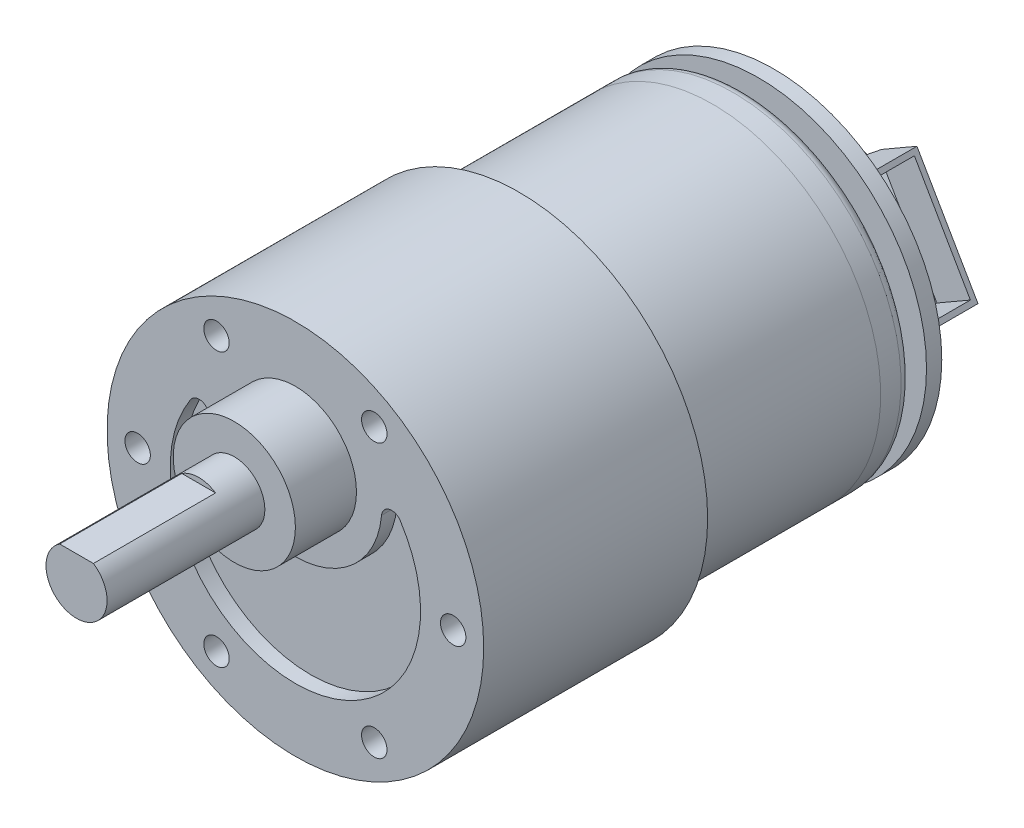
from build123d import *

# Parameters (mm, degrees)
SKETCH1_R            = 18.5
BOSS_EXTRUDE1_DEPTH  = 22
SKETCH2_R            = 1.25
CUT_EXTRUDE1_DEPTH   = 5
SKETCH3_R            = 6
BOSS_EXTRUDE2_DEPTH  = 6
SKETCH4_R            = 3
BOSS_EXTRUDE3_DEPTH  = 15.5
SKETCH5_OUTSIDE_W    = 52.61
SKETCH5_OUTSIDE_H    = 52.61
CUT_EXTRUDE2_DEPTH   = 12
CUT_EXTRUDE3_DEPTH   = 1.5
FILLET1_R            = 1
SKETCH7_R            = 16.5
BOSS_EXTRUDE4_DEPTH  = 19
SKETCH8_R            = 16.5
BOSS_EXTRUDE5_DEPTH  = 3
FILLET2_R            = 1
BOSS_EXTRUDE6_START  = 10
SKETCH9_R            = 7.5
BOSS_EXTRUDE6_DEPTH  = 3.5
BOSS_EXTRUDE7_START  = -4
SKETCH10_R           = 1.5
BOSS_EXTRUDE7_DEPTH  = 10.5
BOSS_EXTRUDE8_START  = 5
SKETCH11_R           = 16.5
SKETCH11_R_2         = 2.25
BOSS_EXTRUDE8_DEPTH  = 1.5
SKETCH12_W           = 1
SKETCH12_H           = 3
BOSS_EXTRUDE9_DEPTH  = 1.5
BOSS_EXTRUDE10_DEPTH = 4.5
CHAMFER1_SIZE        = 2
CUT_EXTRUDE4_START   = -0.5
CUT_EXTRUDE4_DEPTH   = 11
FILLET3_R            = 1
FILLET4_R            = 0.5


with BuildPart() as part:
    # Sketch1 → Boss-Extrude1 (new body)
    with BuildSketch(Plane.XY):
        Circle(SKETCH1_R)
    extrude(amount=-BOSS_EXTRUDE1_DEPTH)

    # Sketch2 → Cut-Extrude1 (cut)
    with BuildSketch(Plane.XY):
        with Locations((-15.5, 0)):
            Circle(SKETCH2_R)
        with Locations((-7.75, 13.423393759)):
            Circle(SKETCH2_R)
        with Locations((7.75, 13.423393759)):
            Circle(SKETCH2_R)
        with Locations((15.5, 0)):
            Circle(SKETCH2_R)
        with Locations((7.75, -13.423393759)):
            Circle(SKETCH2_R)
        with Locations((-7.75, -13.423393759)):
            Circle(SKETCH2_R)
    extrude(amount=-CUT_EXTRUDE1_DEPTH, mode=Mode.SUBTRACT)

    # Sketch3 → Boss-Extrude2 (add)
    with BuildSketch(Plane.XY):
        with Locations((0, 7)):
            Circle(SKETCH3_R)
    extrude(amount=BOSS_EXTRUDE2_DEPTH)

    # Sketch4 → Boss-Extrude3 (add)
    with BuildSketch(Plane.XY.offset(6)):
        with Locations((0, 7)):
            Circle(SKETCH4_R)
    extrude(amount=BOSS_EXTRUDE3_DEPTH)

    # Sketch5 outside → Cut-Extrude2 (cut)
    with BuildSketch(Plane.XY.offset(21.5)):
        Rectangle(SKETCH5_OUTSIDE_W, SKETCH5_OUTSIDE_H)
        with BuildLine():
            Line((-1.658312395, 9.5), (1.658312395, 9.5))
            ThreePointArc((1.658312395, 9.5), (0, 4), (-1.658312395, 9.5))
        make_face(mode=Mode.SUBTRACT)
    extrude(amount=-CUT_EXTRUDE2_DEPTH, mode=Mode.SUBTRACT)

    # Sketch6 → Cut-Extrude3 (cut)
    with BuildSketch(Plane.XY):
        with BuildLine():
            ThreePointArc((-8.226916879, 9.137250258), (0, -12.29518213), (8.226916879, 9.137250258))
            ThreePointArc((8.226916879, 9.137250258), (0, -1.5), (-8.226916879, 9.137250258))
        make_face()
    extrude(amount=-CUT_EXTRUDE3_DEPTH, mode=Mode.SUBTRACT)

    # Fillet1
    fillet1_edges = [part.edges().sort_by_distance(p)[0] for p in [
        (-8.226916879, 9.137250258, -0.75),
        (8.226916879, 9.137250258, -0.75),
    ]]
    fillet(fillet1_edges, radius=FILLET1_R)

    # Sketch7 → Boss-Extrude4 (add)
    with BuildSketch(Plane(origin=(0, 0, -22), x_dir=(-1, 0, 0), z_dir=(0, 0, -1))):
        Circle(SKETCH7_R)
    extrude(amount=BOSS_EXTRUDE4_DEPTH)


with BuildPart() as body_2:
    # Sketch8 → Boss-Extrude5 (new body)
    with BuildSketch(Plane(origin=(0, 0, -41), x_dir=(-1, 0, 0), z_dir=(0, 0, -1))):
        Circle(SKETCH8_R)
    extrude(amount=BOSS_EXTRUDE5_DEPTH)

    # Fillet2
    fillet2_edges = [body_2.edges().sort_by_distance(p)[0] for p in [
        (16.5, 0, -44),
    ]]
    fillet(fillet2_edges, radius=FILLET2_R)



with BuildPart() as body_3:
    # Sketch9 → Boss-Extrude6 (new body)
    with BuildSketch(Plane(origin=(0, 0, -44), x_dir=(-1, 0, 0), z_dir=(0, 0, -1)).offset(BOSS_EXTRUDE6_START)):
        Circle(SKETCH9_R)
    extrude(amount=-BOSS_EXTRUDE6_DEPTH)


with BuildPart() as body_2_1:
    add(body_2.part)

    add(body_3.part)  # Boss-Extrude7 merges body 3
    # Sketch10 → Boss-Extrude7 (add)
    with BuildSketch(Plane.XY.offset(-50.5).offset(BOSS_EXTRUDE7_START)):
        with Locations(Location((0, 0, 0), (0, 0, 180))):
            Circle(SKETCH10_R)
    extrude(amount=BOSS_EXTRUDE7_DEPTH)



with BuildPart() as body_3_2:
    # Sketch11 → Boss-Extrude8 (new body)
    with BuildSketch(Plane.XY.offset(-50.5).offset(BOSS_EXTRUDE8_START)):
        with Locations(Location((0, 0, 0), (0, 0, 180))):
            Circle(SKETCH11_R)
        Circle(SKETCH11_R_2, mode=Mode.SUBTRACT)
    extrude(amount=-BOSS_EXTRUDE8_DEPTH)


with BuildPart() as body_2_2:
    add(body_2_1.part)

    add(body_3_2.part)  # Boss-Extrude9 merges body 3 2
    # Sketch12 → Boss-Extrude9 (add)
    with BuildSketch(Plane.XY.offset(-45.5)):
        with Locations((-12.5, 0)):
            Rectangle(SKETCH12_W, SKETCH12_H)
        with Locations((12.5, 0)):
            Rectangle(SKETCH12_W, SKETCH12_H)
    extrude(amount=BOSS_EXTRUDE9_DEPTH)

    # Sketch13 → Boss-Extrude10 (add)
    with BuildSketch(Plane(origin=(0, 0, -47), x_dir=(-1, 0, 0), z_dir=(0, 0, -1))):
        Polygon((-10.361215932, -0.946152423), (-4.361215932, 9.446152423), (-9.557368355, 12.446152423), (-15.557368355, 2.053847577), align=None)
    extrude(amount=BOSS_EXTRUDE10_DEPTH)

    # Chamfer1
    chamfer1_edges = [body_2_2.edges().sort_by_distance(p)[0] for p in [
        (7.361215932, 4.25, -51.5),
    ]]
    chamfer(chamfer1_edges, length=CHAMFER1_SIZE)

    # Sketch15 → Cut-Extrude4 (cut)
    with BuildSketch(Plane(origin=(3, -5.196152423, 0), x_dir=(0.8660254037844364, 0.5000000000000041, 0), z_dir=(0.5000000000000041, -0.8660254037844364, 0)).offset(CUT_EXTRUDE4_START)):
        Polygon((9, -47.5), (14.5, -47.5), (14.5, -51), (10.707106781, -51), (9, -49.292893219), align=None)
    extrude(amount=-CUT_EXTRUDE4_DEPTH, mode=Mode.SUBTRACT)

    # Fillet3
    # the kernel refuses this fillet: 1 mm, written as the material it takes off along each edge
    with BuildSketch(Plane(origin=(0, 0, -54.5), x_dir=(-1, 0, 0), z_dir=(0, 1, 0))) as fillet3_piece_1:
        with BuildLine():
            CenterArc((0.633974596, 1), FILLET3_R, 270, 60)
            Line((0.633974596, 0), (0.633974596, -0.02))
            Line((0.633974596, -0.02), (1.5, -0.02))
            Line((1.5, -0.02), (1.52, 0))
            ThreePointArc((1.52, 0), (1.52, 0.25), (1.517320508, 0.49))
            Line((1.517320508, 0.49), (1.5, 0.5))
        make_face()
    revolve(axis=Axis((0, 0, -54.5), (0, 0, 1)), mode=Mode.SUBTRACT)

    # Fillet4
    fillet4_edges = [body_2_2.edges().sort_by_distance(p)[0] for p in [
        (7.5, 0, -50.5),
        (7.5, 0, -54),
    ]]
    fillet(fillet4_edges, radius=FILLET4_R)


solid = Compound([part.part, body_2_2.part])
